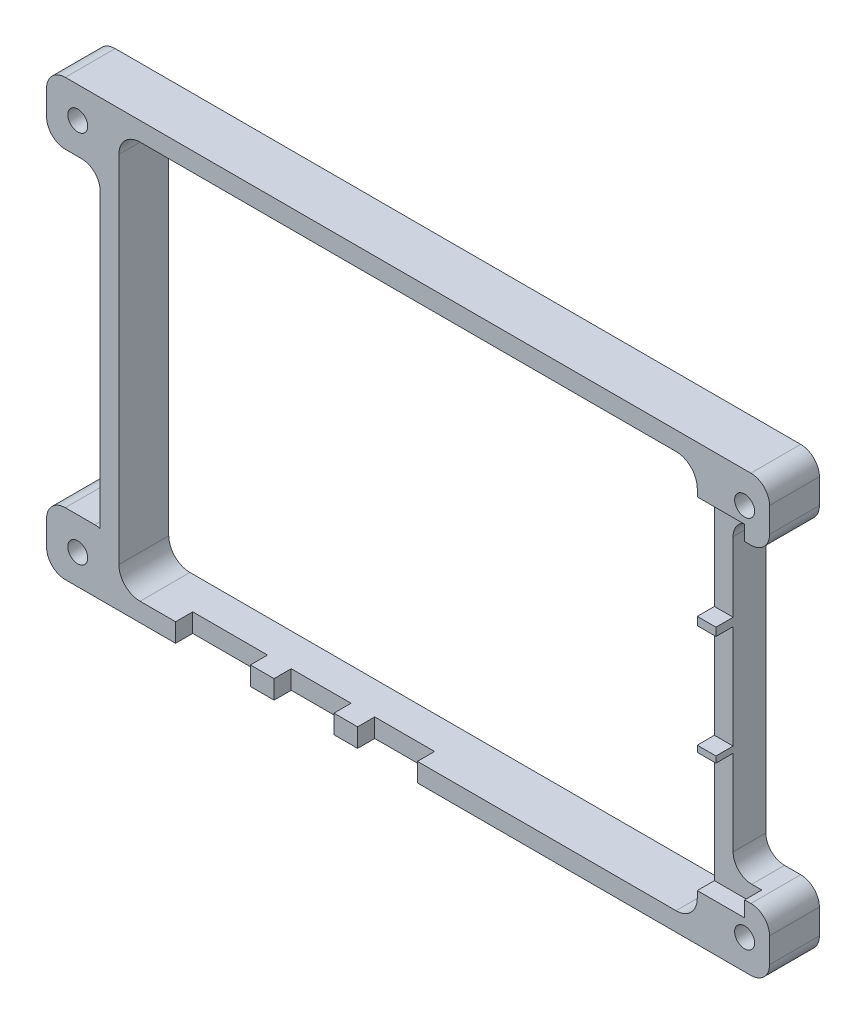
from build123d import *

# Parameters (mm, degrees)
FRAMEOUTSIDE_W                    = 98.8
FRAMEOUTSIDE_H                    = 69.8
FRAME_HEIGHT_8_DEPTH              = 8
OUTSIDE_R6P4_R                    = 6.4
FRAMEINSIDE_W                     = 92.8
FRAMEINSIDE_H                     = 63.8
OPEN_THROUGH_FRAME_DEPTH          = 8.3
INSIDE_R3P4_R                     = 3.4
FOUR_CORNER_EARS_R2_PITCH110X80_R = 1.6
INTEGRAL_EARS_4X3P2_DEPTH         = 8
OPEN_TOP_CABLE_RELIEFS_START      = 5.25
PLUG_CLEARANCE_PROFILES_W         = 12
PLUG_CLEARANCE_PROFILES_H         = 8
PLUG_CLEARANCE_PROFILES_W_2       = 9.6
PLUG_CLEARANCE_PROFILES_W_3       = 8.5
PLUG_CLEARANCE_PROFILES_H_2       = 19.2
PLUG_CLEARANCE_PROFILES_H_3       = 16.6
OPEN_TOP_CABLE_RELIEFS_DEPTH      = 3.25
FILLET_1_R                        = 3


with BuildPart() as part:
    # FrameOutside → Frame_Height_8 (new body)
    with BuildSketch(Plane.XY):
        Rectangle(FRAMEOUTSIDE_W, FRAMEOUTSIDE_H)
    extrude(amount=FRAME_HEIGHT_8_DEPTH)

    # Outside_R6p4
    outside_r6p4_edges = [part.edges().sort_by_distance(p)[0] for p in [
        (49.4, -34.9, 4),
        (-49.4, -34.9, 4),
        (-49.4, 34.9, 4),
        (49.4, 34.9, 4),
    ]]
    fillet(outside_r6p4_edges, radius=OUTSIDE_R6P4_R)

    # FrameInside → Open_Through_Frame (cut)
    with BuildSketch(Plane.XY):
        Rectangle(FRAMEINSIDE_W, FRAMEINSIDE_H)
    extrude(amount=OPEN_THROUGH_FRAME_DEPTH, mode=Mode.SUBTRACT)

    # Inside_R3p4
    inside_r3p4_edges = [part.edges().sort_by_distance(p)[0] for p in [
        (46.4, -31.9, 4),
        (46.4, 31.9, 4),
        (-46.4, 31.9, 4),
        (-46.4, -31.9, 4),
    ]]
    fillet(inside_r3p4_edges, radius=INSIDE_R3P4_R)

    # Four_Corner_Ears_R2_Pitch110x80 → Integral_Ears_4x3p2 (add)
    # profile 1 of 4: a face of its own
    with BuildSketch(Plane.XY):
        Polygon((43, 34.9), (58, 34.9), (58, 24.9), (49.4, 24.9), align=None)
        with Locations((54, 29.9)):
            Circle(FOUR_CORNER_EARS_R2_PITCH110X80_R, mode=Mode.SUBTRACT)
    # profile 2 of 4: a face of its own
    with BuildSketch(Plane.XY):
        Polygon((43, -34.9), (58, -34.9), (58, -24.9), (49.4, -24.9), align=None)
        with Locations((54, -30.1)):
            Circle(FOUR_CORNER_EARS_R2_PITCH110X80_R, mode=Mode.SUBTRACT)
    # profile 3 of 4: a face of its own
    with BuildSketch(Plane.XY):
        Polygon((-43, -34.9), (-58, -34.9), (-58, -24.9), (-49.480769769, -24.9), align=None)
        with Locations((-53, -30.1)):
            Circle(FOUR_CORNER_EARS_R2_PITCH110X80_R, mode=Mode.SUBTRACT)
    # profile 4 of 4: a face of its own
    with BuildSketch(Plane.XY):
        Polygon((-43, 34.9), (-58, 34.9), (-58, 24.9), (-49.4, 24.9), align=None)
        with Locations((-53, 29.9)):
            Circle(FOUR_CORNER_EARS_R2_PITCH110X80_R, mode=Mode.SUBTRACT)
    extrude(amount=INTEGRAL_EARS_4X3P2_DEPTH)

    # Plug_Clearance_Profiles → Open_Top_Cable_Reliefs (cut)
    with BuildSketch(Plane.XY.offset(OPEN_TOP_CABLE_RELIEFS_START)):
        with Locations((-31.3, -35)):
            Rectangle(PLUG_CLEARANCE_PROFILES_W, PLUG_CLEARANCE_PROFILES_H)
        with Locations((-16.7, -35)):
            Rectangle(PLUG_CLEARANCE_PROFILES_W_2, PLUG_CLEARANCE_PROFILES_H)
        with Locations((-3.3, -35)):
            Rectangle(PLUG_CLEARANCE_PROFILES_W_2, PLUG_CLEARANCE_PROFILES_H)
        with Locations((49.75, -17.8)):
            Rectangle(PLUG_CLEARANCE_PROFILES_W_3, PLUG_CLEARANCE_PROFILES_H_2)
        with Locations((49.75, 1.1)):
            Rectangle(PLUG_CLEARANCE_PROFILES_W_3, PLUG_CLEARANCE_PROFILES_H_3)
        with Locations((49.75, 19)):
            Rectangle(PLUG_CLEARANCE_PROFILES_W_3, PLUG_CLEARANCE_PROFILES_H_3)
    extrude(amount=OPEN_TOP_CABLE_RELIEFS_DEPTH, mode=Mode.SUBTRACT)

    # 圆角1
    # the kernel refuses this fillet: 3 mm, written as the material it adds along each edge
    with BuildSketch(Plane(origin=(-49.4, 24.9, 0), x_dir=(0, -1, 0), z_dir=(0, 0, 1))) as fillet_1_piece_1:
        with BuildLine():
            CenterArc((FILLET_1_R, -FILLET_1_R), FILLET_1_R, 90, 90)
            Line((0, -FILLET_1_R), (0, 0))
            Line((0, 0), (FILLET_1_R, 0))
        make_face()
    extrude(amount=8)
    with BuildSketch(Plane(origin=(49.4, -24.9, 0), x_dir=(1, 0, 0), z_dir=(0, 0, 1)), Plane(origin=(49.4, 24.9, 0), x_dir=(0, -1, 0), z_dir=(0, 0, 1))) as fillet_1_piece_2:
        with BuildLine():
            CenterArc((FILLET_1_R, FILLET_1_R), FILLET_1_R, 180, 90)
            Line((0, FILLET_1_R), (0, 0))
            Line((0, 0), (FILLET_1_R, 0))
        make_face()
    extrude(amount=5.25)
    # the kernel refuses this fillet: 3 mm, written as the material it takes off along each edge
    with BuildSketch(Plane(origin=(-58, 34.9, -7.5), x_dir=(1, 0, 0), z_dir=(0, 0, 1)), Plane(origin=(-58, 24.9, -7.5), x_dir=(0, 1, 0), z_dir=(0, 0, 1)), Plane(origin=(-58, -24.9, -7.5), x_dir=(1, 0, 0), z_dir=(0, 0, 1)), Plane(origin=(-58, -34.9, -7.5), x_dir=(0, 1, 0), z_dir=(0, 0, 1)), Plane(origin=(58, -24.9, -7.5), x_dir=(0, -1, 0), z_dir=(0, 0, 1)), Plane(origin=(58, -34.9, -7.5), x_dir=(-1, 0, 0), z_dir=(0, 0, 1)), Plane(origin=(58, 24.9, -7.5), x_dir=(-1, 0, 0), z_dir=(0, 0, 1)), Plane(origin=(58, 34.9, -7.5), x_dir=(0, -1, 0), z_dir=(0, 0, 1))) as fillet_1_2_piece_1:
        with BuildLine():
            CenterArc((FILLET_1_R, -FILLET_1_R), FILLET_1_R, 90, 90)
            Line((0, -FILLET_1_R), (0, 0))
            Line((0, 0), (FILLET_1_R, 0))
        make_face()
    extrude(amount=23, mode=Mode.SUBTRACT)
    with BuildSketch(Plane(origin=(-49.480769769, -24.9, -1.937361077), x_dir=(0.5438533962151781, -0.8391802448968972, 0), z_dir=(0, 0, 1))) as fillet_1_2_piece_2:
        with BuildLine():
            CenterArc((2.096084574, -2.281878246), FILLET_1_R, 130.480576978, 16.573079502)
            Line((-0.421456161, -0.650318057), (0, 0))
            Line((0, 0), (0.148513864, 0))
        make_face()
    extrude(amount=11.874722155, mode=Mode.SUBTRACT)


solid = part.part
